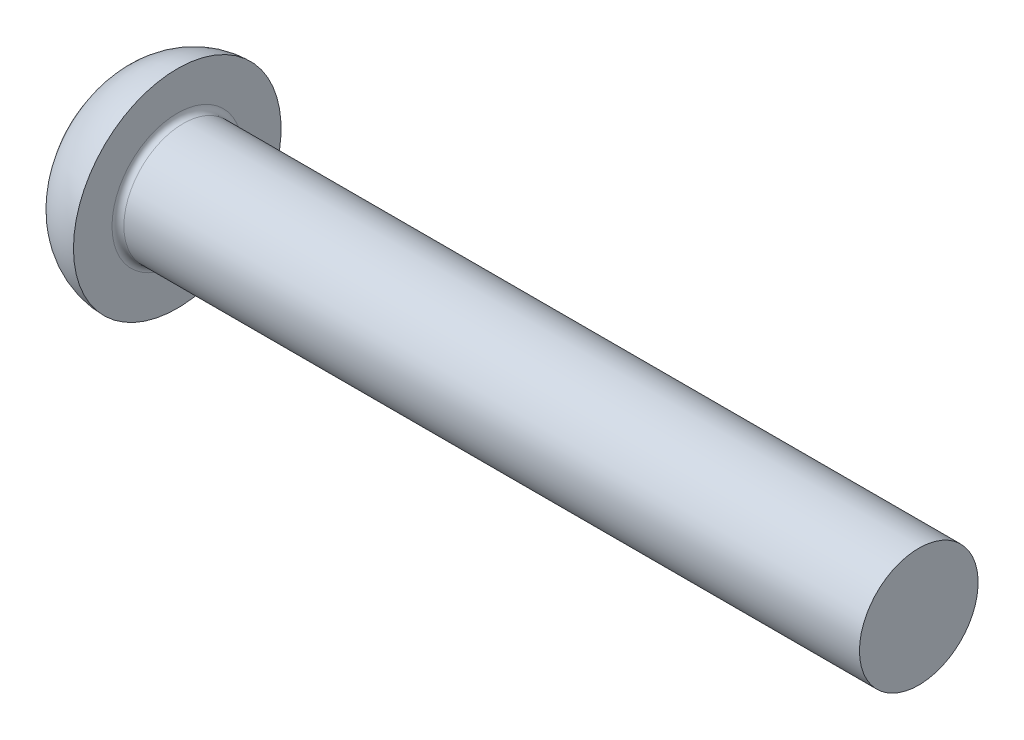
from build123d import *

# Parameters (mm, degrees)
FILLET1_R    = 0.4
RECPAT_COUNT = 2
RECPAT_ANGLE = 90


with BuildPart() as part:
    # BodySke → BaseBody (revolve)
    with BuildSketch(Plane.XY):
        with BuildLine():
            Line((5.4, 4), (5.4, 7))
            ThreePointArc((5.4, 7), (3.455602942, 6.543518244), (1.887955218, 5.30596577))
            ThreePointArc((1.887955218, 5.30596577), (0.486051043, 2.815921148), (0, 0))
            Line((0, 0), (55.4, 0))
            Line((55.4, 0), (55.4, 4))
            Line((55.4, 4), (5.4, 4))
        make_face()
    revolve(axis=Axis((0, 0, 0), (1, 0, 0)))

    # Fillet1
    fillet1_edges = [part.edges().sort_by_distance(p)[0] for p in [
        (5.4, -4, 0),
    ]]
    fillet(fillet1_edges, radius=FILLET1_R)

    # RecSkeTop → Recess section 0
    with BuildSketch(Plane(origin=(0, 0, 0), x_dir=(0, 0, -1), z_dir=(1, 0, 0))):
        with BuildLine():
            Line((-0.847, 3.85), (0.847, 3.85))
            Line((0.847, 3.85), (0.847, -3.85))
            Line((0.847, -3.85), (-0.847, -3.85))
            Line((-0.847, -3.85), (-0.847, 3.85))
        make_face()
    # RecSkeBot → Recess section 1
    with BuildSketch(Plane(origin=(4.26, 0, 0), x_dir=(0, 0, -1), z_dir=(1, 0, 0))):
        with BuildLine():
            Line((-0.847, 1.726042705), (0.847, 1.726042705))
            Line((0.847, 1.726042705), (0.847, -1.726042705))
            Line((0.847, -1.726042705), (-0.847, -1.726042705))
            Line((-0.847, -1.726042705), (-0.847, 1.726042705))
        make_face()
    recess = loft(mode=Mode.SUBTRACT)

    # RecPat: Recess ×2 about axis
    recpat_axis = Axis((0, 0, 0), (1, 0, 0))
    for i in range(1, RECPAT_COUNT):
        add(recess.rotate(recpat_axis, i * RECPAT_ANGLE / (RECPAT_COUNT - 1)), mode=Mode.SUBTRACT)

    # RecCorSke → RecessCore (revolve, cut)
    with BuildSketch(Plane.XY):
        Polygon((0, 0), (0, 1.8634), (4.26, 1.565511781), (4.768665612, 0), align=None)
    revolve(axis=Axis((0, 0, 0), (1, 0, 0)), mode=Mode.SUBTRACT)


solid = part.part
